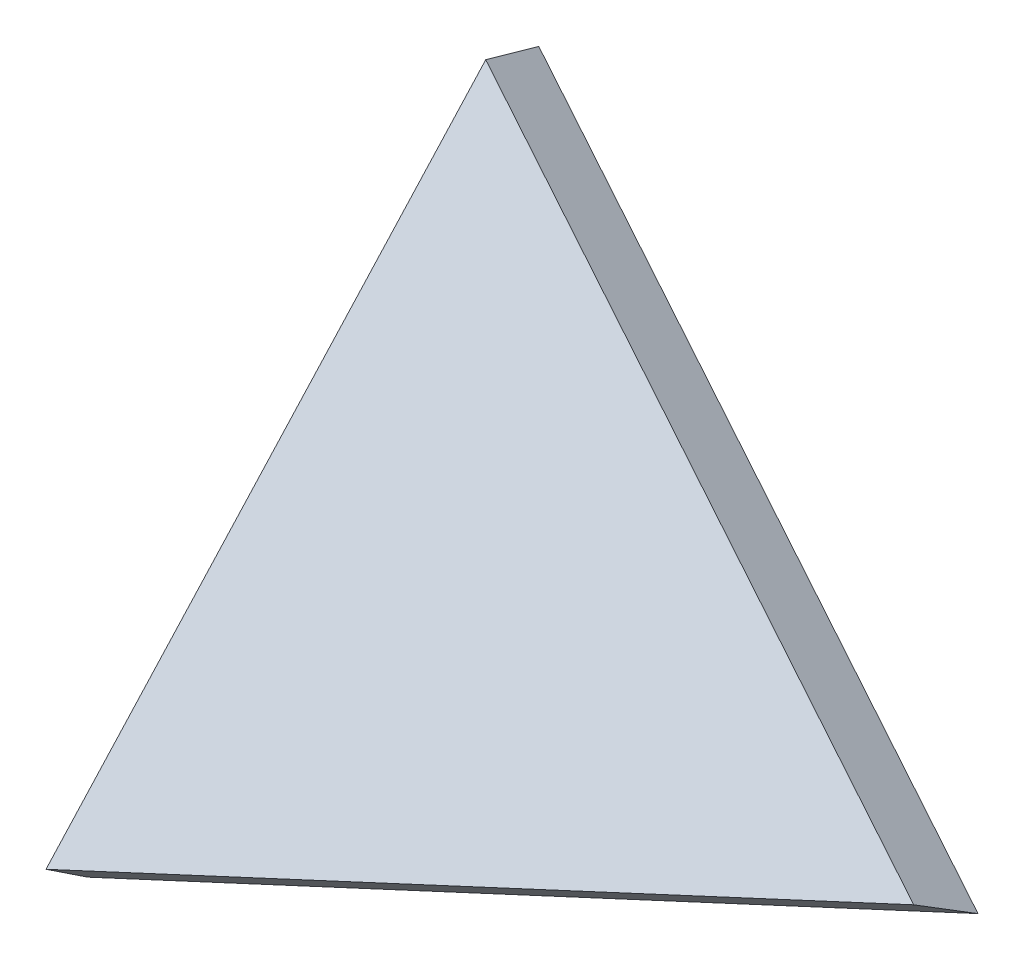
from build123d import *

# Parameters (mm, degrees)
BOSS_EXTRUDE1_DEPTH = 70
CHAMFER1_SIZE2      = 5.656659752
CHAMFER1_SIZE       = 70
CHAMFER2_SIZE2      = 6.666257335
CHAMFER2_SIZE       = 70
CHAMFER3_SIZE2      = 6.943744914
CHAMFER3_SIZE       = 70


with BuildPart() as part:
    # Sketch1 → Boss-Extrude1 (new body)
    with BuildSketch(Plane(origin=(1.818718684, 223.099961208, 297.058264606), x_dir=(0.9998702158319337, -0.015617688744177016, 0.003954654282290165), z_dir=(-0.0037738027640404157, -0.4656867669529911, -0.884941576318781))):
        Polygon((-7529.659322286, 6701.421707533), (-6799.596324061, 7149.151021442), (-7662.519245572, 7518.402613475), align=None)
    extrude(amount=-BOSS_EXTRUDE1_DEPTH)

    # Chamfer1
    chamfer1_edges = [part.edges().sort_by_distance(p)[0] for p in [
        (-7342.900765728, -6120.381828052, 3745.639651246),
    ]]
    chamfer1_side = [part.faces().sort_by_distance(p)[0] for p in [
        (-7342.90119267, -6120.434512683, 3745.539534978),
    ]]
    chamfer(chamfer1_edges, length=CHAMFER1_SIZE - 0.0001, length2=CHAMFER1_SIZE2 - 0.0001, reference=chamfer1_side[0])  # a hair under: the kernel refuses the full size

    # Chamfer2
    chamfer2_edges = [part.edges().sort_by_distance(p)[0] for p in [
        (-7273.007389047, -5758.332698337, 3554.818859194),
    ]]
    chamfer2_side = [part.faces().sort_by_distance(p)[0] for p in [
        (-7273.00789219, -5758.394786093, 3554.700874228),
    ]]
    chamfer(chamfer2_edges, length=CHAMFER2_SIZE - 0.0001, length2=CHAMFER2_SIZE2 - 0.0001, reference=chamfer2_side[0])  # a hair under: the kernel refuses the full size

    # Chamfer3
    chamfer3_edges = [part.edges().sort_by_distance(p)[0] for p in [
        (-7704.423015445, -5916.822424177, 3640.061374094),
    ]]
    chamfer3_side = [part.faces().sort_by_distance(p)[0] for p in [
        (-7704.423539532, -5916.887096379, 3639.938477923),
    ]]
    chamfer(chamfer3_edges, length=CHAMFER3_SIZE - 0.0001, length2=CHAMFER3_SIZE2 - 0.0001, reference=chamfer3_side[0])  # a hair under: the kernel refuses the full size


solid = part.part
